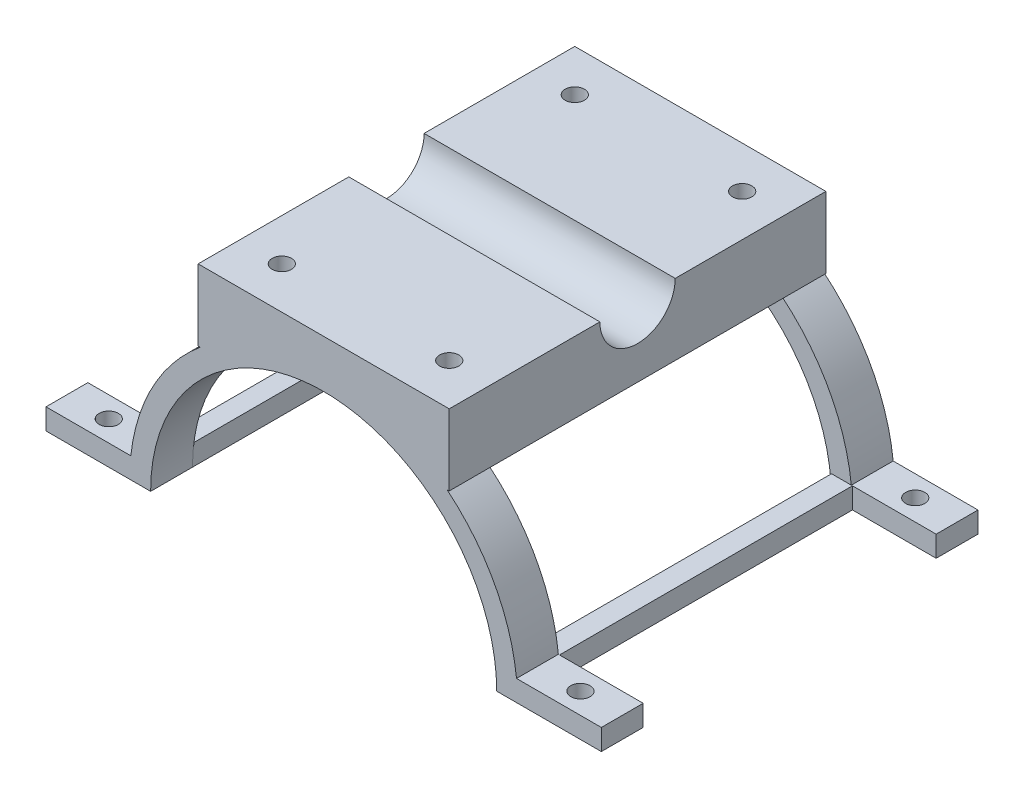
from build123d import *

# Parameters (mm, degrees)
BOSS_EXTRUDE1_DEPTH      = 10
SKETCH2_W                = 10
SKETCH2_H                = 5
BOSS_EXTRUDE2_DEPTH      = 66.35
SKETCH3_R                = 2.3
CUT_EXTRUDE1_DEPTH       = 132.7
SKETCH4_R                = 41.35
CUT_EXTRUDE3_DEPTH       = 50
LPATTERN4_START          = 80
LPATTERN4_DEPTH          = 10
LPATTERN4_2_DEPTH        = 10
LPATTERN4_3_DEPTH        = 10
MIRROR5_COPY_1_SKETCH_R  = 2.3
MIRROR5_COPY_1_DEPTH     = 132.7
SKETCH8_W                = 4.648420871
SKETCH8_H                = 4.94728133
BOSS_EXTRUDE3_DEPTH      = 40
SKETCH11_W               = 60
SKETCH11_H               = 17
BOSS_EXTRUDE4_DEPTH      = 90
SKETCH12_R               = 41.35
CUT_EXTRUDE4_DEPTH       = 250
SKETCH14_R               = 2.3
CUT_EXTRUDE6_DEPTH       = 150
MIRROR8_COPY_1_SKETCH_R  = 2.3
MIRROR8_COPY_1_DEPTH     = 150
SKETCH15_R               = 9
CUT_EXTRUDE7_DEPTH       = 67
SKETCH16_W               = 5
SKETCH16_H               = 90
BOSS_EXTRUDE5_DEPTH      = 5
SKETCH18_R               = 4.75
CUT_EXTRUDE8_DEPTH       = 5
MIRROR10_COPY_1_SKETCH_R = 4.75
MIRROR10_COPY_1_DEPTH    = 5


# Read off the part's stored shape, not the designer's step: LPattern4
with BuildPart() as part:
    # Sketch1 → Boss-Extrude1 (new body)
    with BuildSketch(Plane.XY):
        with BuildLine():
            Line((-46.35, 0), (-41.35, 0))
            ThreePointArc((-41.35, 0), (0, 41.35), (41.35, 0))
            Line((41.35, 0), (46.35, 0))
            ThreePointArc((46.35, 0), (0, 46.35), (-46.35, 0))
        make_face()
    extrude(amount=BOSS_EXTRUDE1_DEPTH)



with BuildPart() as body_2:
    # Sketch2 → Boss-Extrude2 (new, symmetric)
    with BuildSketch(Plane(origin=(0, 0, 0), x_dir=(0, 0, -1), z_dir=(1, 0, 0))):
        with Locations((-5, 2.5)):
            Rectangle(SKETCH2_W, SKETCH2_H)
    extrude(amount=BOSS_EXTRUDE2_DEPTH, both=True)

    # Sketch3 → Cut-Extrude1 (cut)
    with BuildSketch(Plane(origin=(0, 5, 0), x_dir=(1, 0, 0), z_dir=(0, 1, 0))):
        with Locations(Location((56.35, -5, 0), (0, 0, 270))):
            Circle(SKETCH3_R)
    cut_extrude1 = extrude(amount=-CUT_EXTRUDE1_DEPTH, mode=Mode.SUBTRACT)

    # Mirror1: Cut-Extrude1 across plane
    add(cut_extrude1.mirror(Plane(origin=(0, 0, 0), x_dir=(0, 0, 1), z_dir=(1, 0, 0))), mode=Mode.SUBTRACT)

    # Sketch4 → Cut-Extrude3 (cut, symmetric)
    with BuildSketch(Plane.XY):
        Circle(SKETCH4_R)
    extrude(amount=CUT_EXTRUDE3_DEPTH, both=True, mode=Mode.SUBTRACT)


with BuildPart() as cut_extrude3_piece_1:
    # of the separate pieces the step leaves, piece 1, a body of its own (cut_extrude3_pieces)
    add(body_2.part.solids().sort_by_distance((-41.35, 0, 10))[0])


with BuildPart() as cut_extrude3_piece_2:
    # of the separate pieces the step leaves, piece 2, a body of its own (cut_extrude3_pieces)
    add(body_2.part.solids().sort_by_distance((66.35, 0, 10))[0])


with BuildPart() as body_4:
    # LPattern4 outline → LPattern4 (new body)
    with BuildSketch(Plane.XY.offset(LPATTERN4_START)):
        with BuildLine():
            Line((66.35, 0), (66.35, 5))
            Line((66.35, 5), (41.046589383, 5))
            ThreePointArc((41.046589383, 5), (41.274077646, 2.504598671), (41.35, 0))
            Line((41.35, 0), (66.35, 0))
        make_face()
    extrude(amount=LPATTERN4_DEPTH)

    # Mirror5: Cut-Extrude1 across plane
    add(cut_extrude1.mirror(Plane.XY.offset(45)), mode=Mode.SUBTRACT)


with BuildPart() as body_5:
    # LPattern4 2 outline → LPattern4 2 (new body)
    with BuildSketch(Plane.XY.offset(LPATTERN4_START)):
        with BuildLine():
            Line((-46.35, 0), (-41.35, 0))
            ThreePointArc((-41.35, 0), (0, 41.35), (41.35, 0))
            Line((41.35, 0), (46.35, 0))
            ThreePointArc((46.35, 0), (0, 46.35), (-46.35, 0))
        make_face()
    extrude(amount=LPATTERN4_2_DEPTH)


with BuildPart() as body_6:
    # LPattern4 3 outline → LPattern4 3 (new body)
    with BuildSketch(Plane.XY.offset(LPATTERN4_START)):
        with BuildLine():
            Line((-66.35, 0), (-41.35, 0))
            ThreePointArc((-41.35, 0), (-41.274077646, 2.504598671), (-41.046589383, 5))
            Line((-41.046589383, 5), (-66.35, 5))
            Line((-66.35, 5), (-66.35, 0))
        make_face()
    extrude(amount=LPATTERN4_3_DEPTH)

    # Mirror5 copy 1 sketch → Mirror5 copy 1 (cut)
    with BuildSketch(Plane(origin=(0, 5, 90), x_dir=(-1, 0, 0), z_dir=(0, 1, 0))):
        with Locations(Location((56.35, -5, 0), (0, 0, 270))):
            Circle(MIRROR5_COPY_1_SKETCH_R)
    extrude(amount=-MIRROR5_COPY_1_DEPTH, mode=Mode.SUBTRACT)


with BuildPart() as part_1:
    add(part.part)

    add(cut_extrude3_piece_1.part)  # Boss-Extrude3 merges Cut-Extrude3 piece 1

    add(body_5.part)  # Boss-Extrude3 merges body 5

    add(body_6.part)  # Boss-Extrude3 merges body 6
    # Sketch8 → Boss-Extrude3 (add, symmetric)
    with BuildSketch(Plane.XY.offset(45)):
        with Locations((-43.674210436, 2.473640665)):
            Rectangle(SKETCH8_W, SKETCH8_H)
    boss_extrude3 = extrude(amount=BOSS_EXTRUDE3_DEPTH, both=True)

    # Mirror6: Boss-Extrude3 across plane
    add(boss_extrude3.mirror(Plane(origin=(0, 0, 0), x_dir=(0, 0, 1), z_dir=(1, 0, 0))))

    # Sketch11 → Boss-Extrude4 (add)
    with BuildSketch(Plane.XY.offset(90)):
        with Locations((0, 44.255632839)):
            Rectangle(SKETCH11_W, SKETCH11_H)
    extrude(amount=-BOSS_EXTRUDE4_DEPTH)

    # Sketch12 → Cut-Extrude4 (cut, symmetric)
    with BuildSketch(Plane.XY.offset(90)):
        Circle(SKETCH12_R)
    extrude(amount=CUT_EXTRUDE4_DEPTH, both=True, mode=Mode.SUBTRACT)

    # Sketch14 → Cut-Extrude6 (cut, symmetric)
    with BuildSketch(Plane(origin=(0, 52.755632839, 0), x_dir=(1, 0, 0), z_dir=(0, 1, 0))):
        with Locations(Location((20, -80, 0), (0, 0, 270))):
            Circle(SKETCH14_R)
    cut_extrude6 = extrude(amount=CUT_EXTRUDE6_DEPTH, both=True, mode=Mode.SUBTRACT)

    # Mirror7: Cut-Extrude6 across plane
    add(cut_extrude6.mirror(Plane(origin=(0, 0, 0), x_dir=(0, 0, 1), z_dir=(1, 0, 0))), mode=Mode.SUBTRACT)

    # Mirror8: Cut-Extrude6 across plane
    add(cut_extrude6.mirror(Plane.XY.offset(45)), mode=Mode.SUBTRACT)

    # Mirror8 copy 1 sketch → Mirror8 copy 1 (cut, symmetric)
    with BuildSketch(Plane(origin=(0, 52.755632839, 90), x_dir=(-1, 0, 0), z_dir=(0, 1, 0))):
        with Locations(Location((20, -80, 0), (0, 0, 270))):
            Circle(MIRROR8_COPY_1_SKETCH_R)
    extrude(amount=MIRROR8_COPY_1_DEPTH, both=True, mode=Mode.SUBTRACT)

    # Sketch15 → Cut-Extrude7 (cut)
    with BuildSketch(Plane.ZY.offset(30)):
        with Locations((45, 52.755632839)):
            Circle(SKETCH15_R)
    extrude(amount=-CUT_EXTRUDE7_DEPTH, mode=Mode.SUBTRACT)


    add(cut_extrude3_piece_2.part)  # Boss-Extrude5 merges Cut-Extrude3 piece 2

    add(body_4.part)  # Boss-Extrude5 merges body 4
    # Sketch16 → Boss-Extrude5 (add)
    with BuildSketch(Plane.XZ):
        with Locations((43.85, 45)):
            Rectangle(SKETCH16_W, SKETCH16_H)
    extrude(amount=-BOSS_EXTRUDE5_DEPTH)

    # Sketch18 → Cut-Extrude8 (cut, symmetric)
    with BuildSketch(Plane.XZ.offset(-35.755632839)):
        with Locations(Location((20, 80, 0), (0, 0, 270))):
            Circle(SKETCH18_R)
    cut_extrude8 = extrude(amount=CUT_EXTRUDE8_DEPTH, both=True, mode=Mode.SUBTRACT)

    # Mirror9: Cut-Extrude8 across plane
    add(cut_extrude8.mirror(Plane.XY.offset(45)), mode=Mode.SUBTRACT)

    # Mirror10: Cut-Extrude8 across plane
    add(cut_extrude8.mirror(Plane(origin=(0, 0, 0), x_dir=(0, 0, 1), z_dir=(1, 0, 0))), mode=Mode.SUBTRACT)

    # Mirror10 copy 1 sketch → Mirror10 copy 1 (cut, symmetric)
    with BuildSketch(Plane(origin=(0, 35.755632839, 90), x_dir=(-1, 0, 0), z_dir=(0, -1, 0))):
        with Locations(Location((20, 80, 0), (0, 0, 270))):
            Circle(MIRROR10_COPY_1_SKETCH_R)
    extrude(amount=MIRROR10_COPY_1_DEPTH, both=True, mode=Mode.SUBTRACT)


solid = part_1.part
